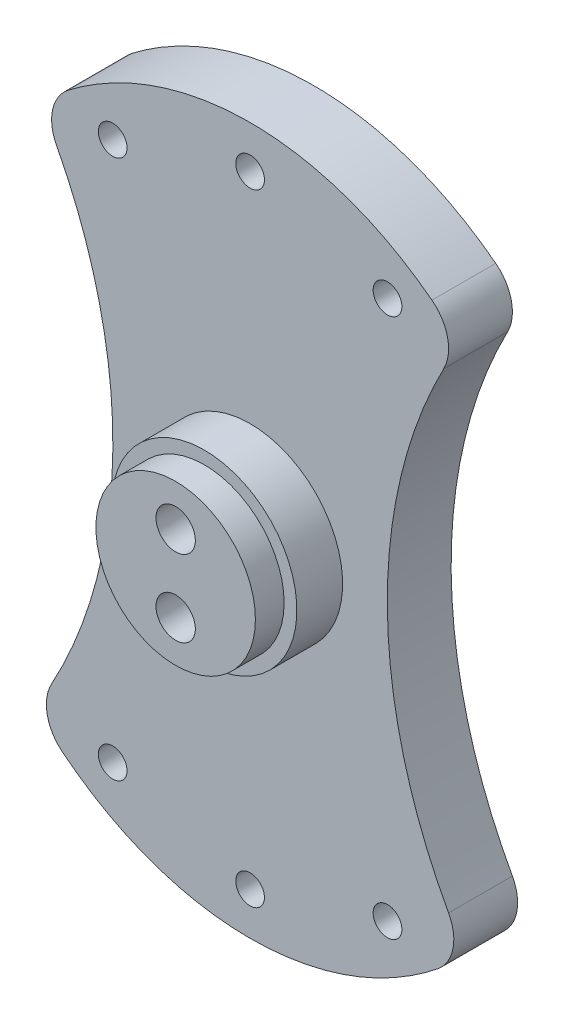
from build123d import *

# Parameters (mm, degrees)
BOSS_EXTRUDE1_OUTLINE_R = 1.35
BOSS_EXTRUDE1_DEPTH     = 6
FILLET2_R               = 4
SKETCH6_R               = 7.5
BOSS_EXTRUDE5_DEPTH     = 7
SKETCH7_R               = 1.85
CUT_EXTRUDE2_DEPTH      = 41.49625976
SKETCH8_R               = 2.1
CUT_EXTRUDE3_DEPTH      = 5
SKETCH10_R              = 8.7
SKETCH10_R_2            = 7.5
BOSS_EXTRUDE6_DEPTH     = 4.3


# Read off the part's stored shape, not the designer's step: Boss-Extrude1
with BuildPart() as part:
    # Boss-Extrude1 outline → Boss-Extrude1 (new body)
    with BuildSketch(Plane.XY):
        with BuildLine():
            add(Edge.make_bspline(
                [(19.759245017, 25.011508548), (17.277632704, 27.410130174), (11.065749819, 31.662666447), (3.898055626, 33.225), (0, 33.225), (-3.898055626, 33.225), (-11.065749819, 31.662666447), (-17.277632704, 27.410130174), (-19.759245017, 25.011508548)],
                knots=[5.561095323, 5.561095323, 5.561095323, 5.561095323, 5.890486225, 6.283185307, 6.283185307, 6.283185307, 6.675884389, 7.005275292, 7.005275292, 7.005275292, 7.005275292], degree=3))
            ThreePointArc((-19.759245017, 25.011508548), (-12.906795412, 0.176983829), (-20.263531469, -24.512854531))
            add(Edge.make_bspline(
                [(-20.263531469, -24.512854531), (-17.664381341, -27.142112776), (-11.289415252, -31.613914365), (0, -34.074654426), (11.289415252, -31.613914365), (17.664381341, -27.142112776), (20.263531469, -24.512854531)],
                knots=[2.396970099, 2.396970099, 2.396970099, 2.396970099, 2.748893572, 3.141592654, 3.534291735, 3.886215208, 3.886215208, 3.886215208, 3.886215208], degree=3))
            ThreePointArc((20.263531469, -24.512854531), (12.906795412, 0.176983829), (19.759245017, 25.011508548))
        make_face()
        with Locations((-12.92155431, -25.359978236)):
            Circle(BOSS_EXTRUDE1_OUTLINE_R, mode=Mode.SUBTRACT)
        with Locations((0, -29.225)):
            Circle(BOSS_EXTRUDE1_OUTLINE_R, mode=Mode.SUBTRACT)
        with Locations((12.92155431, -25.359978236)):
            Circle(BOSS_EXTRUDE1_OUTLINE_R, mode=Mode.SUBTRACT)
        with Locations((-12.92155431, 25.359978236)):
            Circle(BOSS_EXTRUDE1_OUTLINE_R, mode=Mode.SUBTRACT)
        with Locations((0, 29.225)):
            Circle(BOSS_EXTRUDE1_OUTLINE_R, mode=Mode.SUBTRACT)
        with Locations((12.92155431, 25.359978236)):
            Circle(BOSS_EXTRUDE1_OUTLINE_R, mode=Mode.SUBTRACT)
    extrude(amount=BOSS_EXTRUDE1_DEPTH)

    # Fillet2
    fillet2_edges = [part.edges().sort_by_distance(p)[0] for p in [
        (-20.263531469, -24.512854531, 3),
        (-19.759245017, 25.011508548, 3),
        (19.759245017, 25.011508548, 3),
        (20.263531469, -24.512854531, 3),
    ]]
    fillet(fillet2_edges, radius=FILLET2_R)

    # Sketch6 → Boss-Extrude5 (add)
    with BuildSketch(Plane.XY.offset(6)):
        Circle(SKETCH6_R)
    extrude(amount=BOSS_EXTRUDE5_DEPTH)

    # Sketch7 → Cut-Extrude2 (cut, through all)
    with BuildSketch(Plane(origin=(0, 0, 0), x_dir=(-1, 0, 0), z_dir=(0, 0, -1))):
        with Locations((0, 3.6)):
            Circle(SKETCH7_R)
        with Locations((0, -3.6)):
            Circle(SKETCH7_R)
    extrude(amount=-CUT_EXTRUDE2_DEPTH, mode=Mode.SUBTRACT)

    # Sketch8 → Cut-Extrude3 (cut)
    with BuildSketch(Plane(origin=(0, 0, 0), x_dir=(-1, 0, 0), z_dir=(0, 0, -1))):
        with Locations((10, 0)):
            Circle(SKETCH8_R)
        with Locations((0, -10)):
            Circle(SKETCH8_R)
        with Locations((-10, 0)):
            Circle(SKETCH8_R)
        with Locations((0, 10)):
            Circle(SKETCH8_R)
    extrude(amount=-CUT_EXTRUDE3_DEPTH, mode=Mode.SUBTRACT)

    # Sketch10 → Boss-Extrude6 (add)
    with BuildSketch(Plane.XY.offset(6)):
        with Locations(Location((0, 0, 0), (0, 0, 180))):
            Circle(SKETCH10_R)
        Circle(SKETCH10_R_2, mode=Mode.SUBTRACT)
    extrude(amount=BOSS_EXTRUDE6_DEPTH)


solid = part.part
